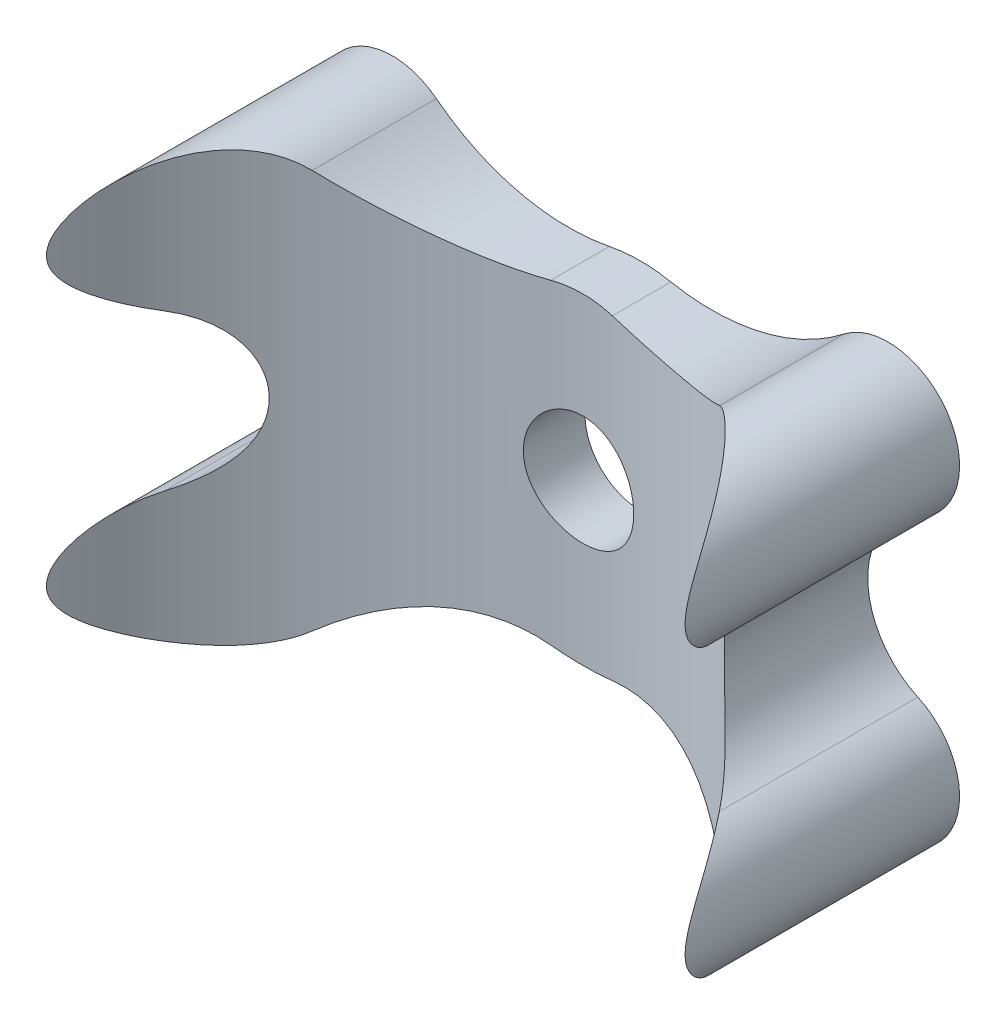
from build123d import *

# Parameters (mm, degrees)
SKETCH2_W                      = 30.48
SKETCH2_H                      = 152.4
BOSS_EXTRUDE1_DEPTH            = 25.4
BOSS_EXTRUDE1_DEPTH_BACK       = 5.08
SKETCH4_R                      = 4.89966
F_5_0MM_DOWEL_HOLE1_AT_2_COUNT = 2
F_5_0MM_DOWEL_HOLE1_AT_2_PITCH = 50.8
F_5_0MM_DOWEL_HOLE1_AT_3_COUNT = 2
F_5_0MM_DOWEL_HOLE1_AT_3_PITCH = 43.994090512
F_5_0MM_DOWEL_HOLE1_AT_4_COUNT = 2
F_5_0MM_DOWEL_HOLE1_AT_4_PITCH = 25.4


with BuildPart() as part:
    # Sketch2 → Revolve1 (revolve)
    with BuildSketch(Plane(origin=(0, 0, 0), x_dir=(0, 0, -1), z_dir=(1, 0, 0))):
        with Locations((15.24, 0)):
            Rectangle(SKETCH2_W, SKETCH2_H)
    revolve(axis=Axis((0, -76.2, 0), (0, 1, 0)))


with BuildPart() as body_2:
    # Sketch4 → Boss-Extrude1 (new, two sides: drawn at the far end of the back side and taken through both)
    with BuildSketch(Plane(origin=(0, 0, -30.48), x_dir=(-1, 0, 0), z_dir=(0, 0, 1)).offset(-BOSS_EXTRUDE1_DEPTH_BACK)):
        with BuildLine():
            ThreePointArc((-24.642441225, -6.927272727), (-20.196916389, 0), (-24.642441225, 6.927272727))
            ThreePointArc((-24.642441225, 6.927272727), (-27.423118543, 15.998519166), (-18.090128015, 17.705846349))
            ThreePointArc((-18.090128015, 17.705846349), (-10.809478571, 14.198051615), (-2.729732697, 14.024308028))
            ThreePointArc((-2.729732697, 14.024308028), (0, 14.2875), (2.729732697, 14.024308028))
            ThreePointArc((2.729732697, 14.024308028), (10.809478571, 14.198051615), (18.090128015, 17.705846349))
            ThreePointArc((18.090128015, 17.705846349), (27.423118543, 15.998519166), (24.642441225, 6.927272727))
            ThreePointArc((24.642441225, 6.927272727), (20.196916389, 0), (24.642441225, -6.927272727))
            ThreePointArc((24.642441225, -6.927272727), (27.423118543, -15.998519166), (18.090128015, -17.705846349))
            ThreePointArc((18.090128015, -17.705846349), (10.809478571, -14.198051615), (2.729732697, -14.024308028))
            ThreePointArc((2.729732697, -14.024308028), (0, -14.2875), (-2.729732697, -14.024308028))
            ThreePointArc((-2.729732697, -14.024308028), (-10.809478571, -14.198051615), (-18.090128015, -17.705846349))
            ThreePointArc((-18.090128015, -17.705846349), (-27.423118543, -15.998519166), (-24.642441225, -6.927272727))
        make_face()
        Circle(SKETCH4_R, mode=Mode.SUBTRACT)
    extrude(amount=BOSS_EXTRUDE1_DEPTH + BOSS_EXTRUDE1_DEPTH_BACK)

    # Sketch10 → Ø5.0mm Dowel Hole1 (revolve, cut)
    with BuildSketch(Plane(origin=(-21.997045256, 12.7, -35.56), x_dir=(0, 1, 0), z_dir=(1, 0, 0))):
        Polygon((0, 0), (0, 6.582151548), (2.5, 5.08), (2.5, 0), align=None)
    f_5_0mm_dowel_hole1 = revolve(axis=Axis((-21.997045256, 12.7, -41.91), (0, 0, 1)), mode=Mode.SUBTRACT)

    # Ø5.0mm Dowel Hole1 at 2: Ø5.0mm Dowel Hole1 ×2
    with Locations(*[Vector(0.8660254037844379, -0.5000000000000014, -6.031920370010707e-15) * (i * F_5_0MM_DOWEL_HOLE1_AT_2_PITCH) for i in range(1, F_5_0MM_DOWEL_HOLE1_AT_2_COUNT)]):
        add(f_5_0mm_dowel_hole1, mode=Mode.SUBTRACT)

    # Ø5.0mm Dowel Hole1 at 3: Ø5.0mm Dowel Hole1 ×2
    with Locations(*[(i * F_5_0MM_DOWEL_HOLE1_AT_3_PITCH, 0, 0) for i in range(1, F_5_0MM_DOWEL_HOLE1_AT_3_COUNT)]):
        add(f_5_0mm_dowel_hole1, mode=Mode.SUBTRACT)

    # Ø5.0mm Dowel Hole1 at 4: Ø5.0mm Dowel Hole1 ×2
    with Locations(*[(0, -i * F_5_0MM_DOWEL_HOLE1_AT_4_PITCH, 0) for i in range(1, F_5_0MM_DOWEL_HOLE1_AT_4_COUNT)]):
        add(f_5_0mm_dowel_hole1, mode=Mode.SUBTRACT)

    # Combine4: cut part
    add(part.part, mode=Mode.SUBTRACT)


solid = body_2.part
